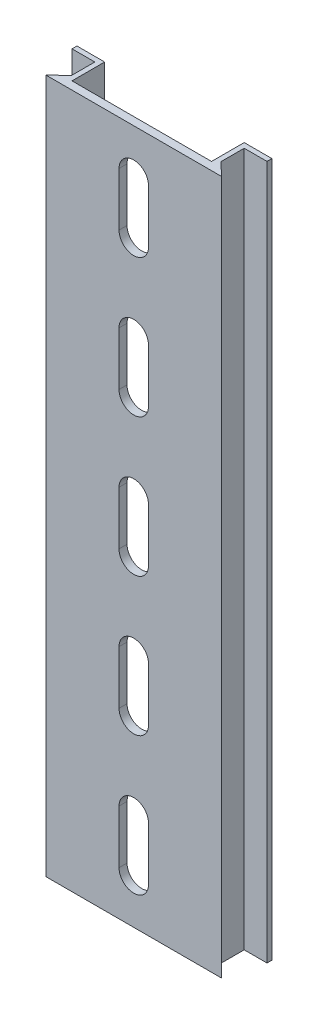
from build123d import *

# Parameters (mm, degrees)
BOSS_EXTRUDE1_DEPTH  = 62.865
CUT_EXTRUDE1_DEPTH   = 66.710688552
LPATTERN1_COUNT      = 3
LPATTERN1_PITCH      = 25
LPATTERN1_COUNT_DIR2 = 3
LPATTERN1_PITCH_DIR2 = 25


with BuildPart() as part:
    # Sketch1 → Boss-Extrude1 (new, symmetric)
    with BuildSketch(Plane(origin=(0, 0, 0), x_dir=(1, 0, 0), z_dir=(0, 1, 0))):
        Polygon((-15.875, 0), (15.875, 0), (13.5255, 2.286), (13.5255, 6.477), (17.653, 6.477), (17.653, 7.366), (12.6365, 7.366), (12.6365, 1.4478), (-12.6365, 1.4478), (-12.6365, 7.366), (-17.653, 7.366), (-17.653, 6.477), (-13.5255, 6.477), (-13.5255, 2.286), align=None)
    extrude(amount=BOSS_EXTRUDE1_DEPTH, both=True)

    # Sketch2 → Cut-Extrude1 (cut, through all)
    with BuildSketch(Plane.XY):
        with BuildLine():
            Line((-2.667, -4.833), (-2.667, 4.833))
            ThreePointArc((-2.667, 4.833), (0, 7.5), (2.667, 4.833))
            Line((2.667, 4.833), (2.667, -4.833))
            ThreePointArc((2.667, -4.833), (0, -7.5), (-2.667, -4.833))
        make_face()
    cut_extrude1 = extrude(amount=-CUT_EXTRUDE1_DEPTH, mode=Mode.SUBTRACT)

    # LPattern1: Cut-Extrude1 3 × 3
    with Locations(*[Vector(0, -1, 0) * (i * LPATTERN1_PITCH) + Vector(0, 1, 0) * (j * LPATTERN1_PITCH_DIR2) for i in range(LPATTERN1_COUNT) for j in range(LPATTERN1_COUNT_DIR2) if (i, j) != (0, 0)]):
        add(cut_extrude1, mode=Mode.SUBTRACT)


solid = part.part
